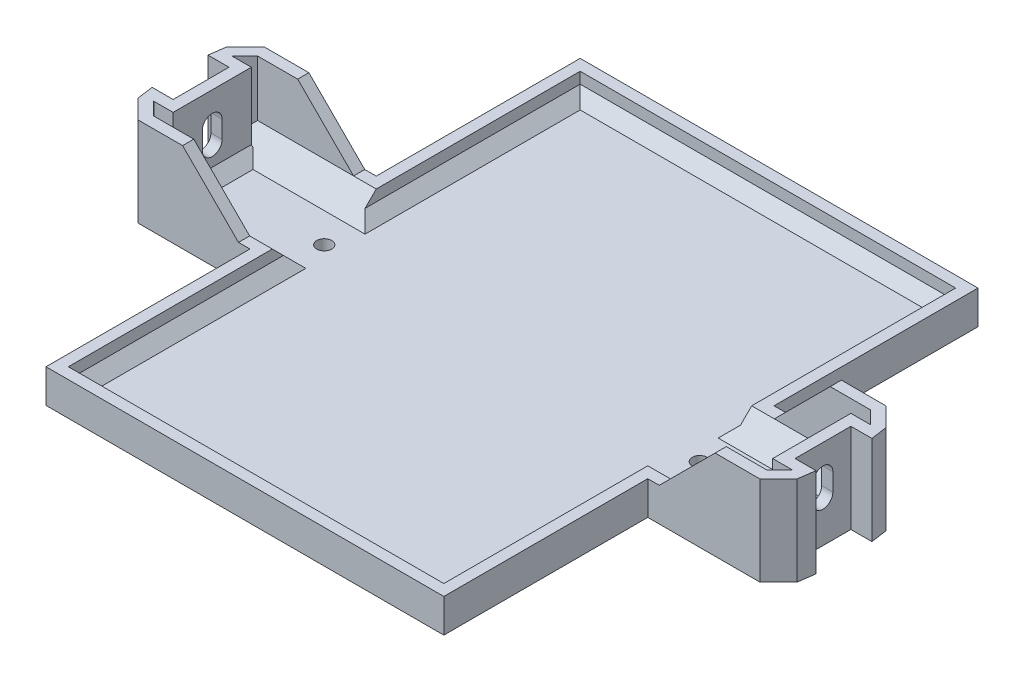
from build123d import *

# Parameters (mm, degrees)
SKETCH4_W                = 90.422573022
SKETCH4_H                = 121.412
BOSS_EXTRUDE2_DEPTH      = 2.54
BOSS_EXTRUDE3_DEPTH      = 2.54
BOSS_EXTRUDE4_DEPTH      = 17.78
SKETCH7_W                = 121.034311438
SKETCH7_H                = 121.412
CUT_EXTRUDE1_DEPTH       = 12.7
CHAMFER1_SIZE            = 12.7
CHAMFER3_SIZE            = 5.08
CHAMFER4_SIZE            = 2.54
M4_START                 = -70.677155719
M4_CLEARANCE_SLOT1_DEPTH = 141.354311438
M3_CLEARANCE_HOLE1_D     = 3.4


# Read off the part's stored shape, not the designer's step: M4 Clearance Slot1
with BuildPart() as part:
    # Sketch4 → Boss-Extrude2 (new body)
    with BuildSketch(Plane(origin=(0, 0, 0), x_dir=(1, 0, 0), z_dir=(0, 1, 0))):
        Rectangle(SKETCH4_W, SKETCH4_H)
    extrude(amount=BOSS_EXTRUDE2_DEPTH)

    # Sketch5 → Boss-Extrude3 (add)
    with BuildSketch(Plane(origin=(0, 0, 0), x_dir=(1, 0, 0), z_dir=(0, 1, 0))):
        Polygon((45.211286511, 14.351), (70.694027546, 14.351), (74.922106204, 10.122921342), (75.452355719, 6.35), (70.677155719, 6.35), (70.677155719, -6.35), (75.452355719, -6.35), (74.922106204, -10.122921342), (70.694027546, -14.351), (45.211286511, -14.351), align=None)
        Polygon((-45.211286511, 14.351), (-45.211286511, -14.351), (-70.694027546, -14.351), (-74.922106204, -10.122921342), (-75.452355719, -6.35), (-70.677155719, -6.35), (-70.677155719, 6.35), (-75.452355719, 6.35), (-74.922106204, 10.122921342), (-70.694027546, 14.351), align=None)
    extrude(amount=BOSS_EXTRUDE3_DEPTH)

    # Sketch6 → Boss-Extrude4 (add)
    with BuildSketch(Plane(origin=(0, 2.54, 0), x_dir=(1, 0, 0), z_dir=(0, 1, 0))):
        Polygon((45.211286511, -60.706), (45.211286511, -14.351), (70.694027546, -14.351), (74.922106204, -10.122921342), (75.452355719, -6.35), (70.677155719, -6.35), (70.677155719, 6.35), (75.452355719, 6.35), (74.922106204, 10.122921342), (70.694027546, 14.351), (45.211286511, 14.351), (45.211286511, 60.706), (-45.211286511, 60.706), (-45.211286511, 14.351), (-70.694027546, 14.351), (-74.922106204, 10.122921342), (-75.452355719, 6.35), (-70.677155719, 6.35), (-70.677155719, -6.35), (-75.452355719, -6.35), (-74.922106204, -10.122921342), (-70.694027546, -14.351), (-45.211286511, -14.351), (-45.211286511, -60.706), align=None)
        Polygon((42.671286511, -58.166), (42.671286511, -11.811), (69.641925098, -11.811), (72.525104647, -8.927820451), (72.530419964, -8.89), (68.137155719, -8.89), (68.137155719, 8.89), (72.530419964, 8.89), (72.525104647, 8.927820451), (69.641925098, 11.811), (42.671286511, 11.811), (42.671286511, 58.166), (-42.671286511, 58.166), (-42.671286511, 11.811), (-69.641925098, 11.811), (-72.525104647, 8.927820451), (-72.530419964, 8.89), (-68.137155719, 8.89), (-68.137155719, -8.89), (-72.530419964, -8.89), (-72.525104647, -8.927820451), (-69.641925098, -11.811), (-42.671286511, -11.811), (-42.671286511, -58.166), align=None, mode=Mode.SUBTRACT)
    extrude(amount=BOSS_EXTRUDE4_DEPTH)

    # Sketch7 → Cut-Extrude1 (cut)
    with BuildSketch(Plane(origin=(0, 20.32, 0), x_dir=(1, 0, 0), z_dir=(0, 1, 0))):
        Rectangle(SKETCH7_W, SKETCH7_H)
    extrude(amount=-CUT_EXTRUDE1_DEPTH, mode=Mode.SUBTRACT)

    # Chamfer1
    chamfer1_edges = [part.edges().sort_by_distance(p)[0] for p in [
        (-60.517155719, 7.62, -13.081),
        (-60.517155719, 7.62, 13.081),
        (60.517155719, 7.62, 13.081),
        (60.517155719, 7.62, -13.081),
    ]]
    chamfer(chamfer1_edges, length=CHAMFER1_SIZE - 0.0001)  # a hair under: the kernel refuses the full size

    # Chamfer3
    chamfer3_edges = [part.edges().sort_by_distance(p)[0] for p in [
        (-56.156605804, 2.54, 11.811),
        (-56.156605804, 2.54, -11.811),
        (56.156605804, 2.54, 11.811),
        (56.156605804, 2.54, -11.811),
    ]]
    chamfer(chamfer3_edges, length=CHAMFER3_SIZE - 0.0001)  # a hair under: the kernel refuses the full size

    # Chamfer4
    chamfer4_edges = [part.edges().sort_by_distance(p)[0] for p in [
        (42.671286511, 2.54, 32.44855),
        (0, 2.54, 58.166),
        (-42.671286511, 2.54, 32.44855),
        (-42.671286511, 2.54, -32.44855),
        (42.671286511, 2.54, -32.44855),
        (0, 2.54, -58.166),
        (-68.137155719, 2.54, 0),
        (68.137155719, 2.54, 0),
    ]]
    chamfer(chamfer4_edges, length=CHAMFER4_SIZE)

    # M4 Clearance Slot1 outline → M4 Clearance Slot1 (cut)
    with BuildSketch(Plane.YZ.offset(M4_START)):
        with BuildLine():
            Line((9.43, -2.25), (13.43, -2.25))
            ThreePointArc((13.43, -2.25), (15.68, 0), (13.43, 2.25))
            Line((13.43, 2.25), (9.43, 2.25))
            ThreePointArc((9.43, 2.25), (7.18, 0), (9.43, -2.25))
        make_face()
    extrude(amount=M4_CLEARANCE_SLOT1_DEPTH, mode=Mode.SUBTRACT)

    # M3 Clearance Hole1 (through all)
    with Locations(Plane(origin=(0, 2.54, 0), x_dir=(1, 0, 0), z_dir=(0, 1, 0))):
        with Locations((42.671286511, 0), (-42.671286511, 0)):
            Hole(M3_CLEARANCE_HOLE1_D / 2)


solid = part.part
